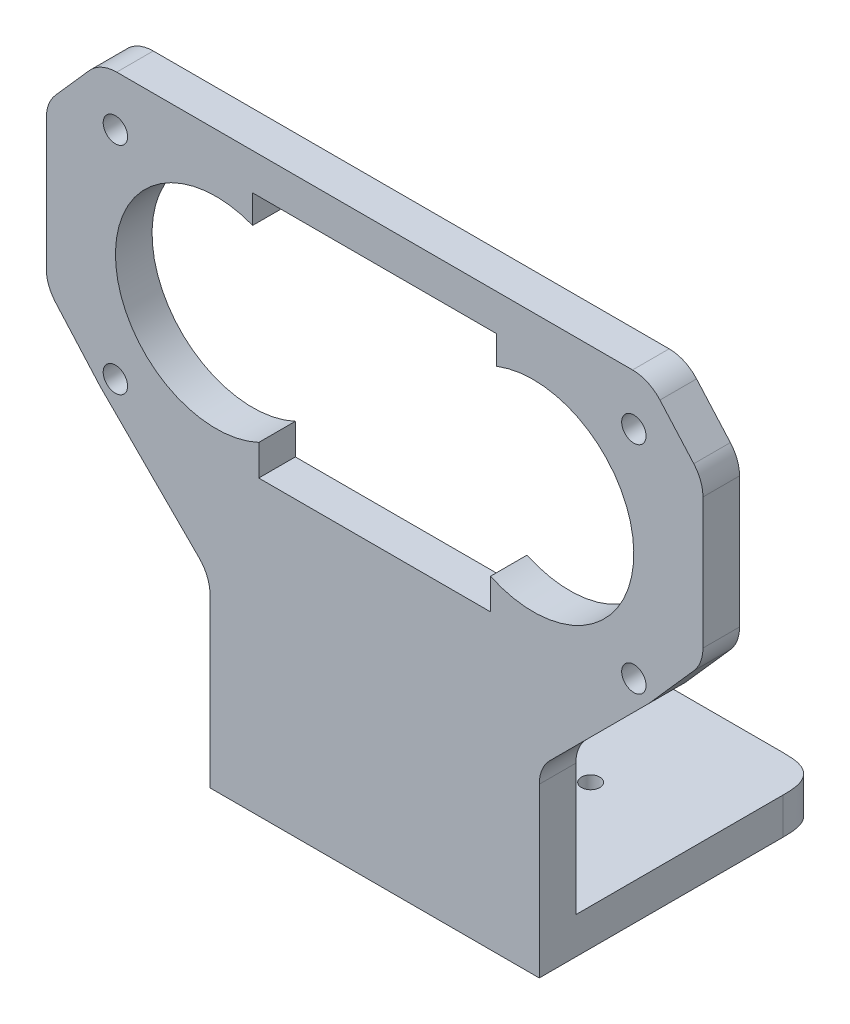
from build123d import *

# Parameters (mm, degrees)
EXTRUDE_1_DEPTH     = 3
SKETCH_2_W          = 27
SKETCH_2_H          = 3
EXTRUDE_2_DEPTH     = 20
FILLET_1_SIZE       = 3
FILLET_2_SIZE       = 3
SKETCH_3_R          = 2.5
SKETCH_3_R_2        = 0.75
CUT_EXTRUDE_1_DEPTH = 20
SKETCH_4_R          = 1
CUT_EXTRUDE_2_DEPTH = 10


with BuildPart() as part:
    # 草图1 → 凸台-拉伸1 (new body)
    with BuildSketch(Plane.XY):
        with BuildLine():
            Line((-10, 23), (-21.14797242, 23))
            ThreePointArc((-21.14797242, 23), (-22.380603493, 22.735072328), (-23.395529179, 21.987080425))
            Line((-23.395529179, 21.987080425), (-26.168091228, 18.851077224))
            ThreePointArc((-26.168091228, 18.851077224), (-26.72612445, 17.926383199), (-26.920534469, 16.863996799))
            Line((-26.920534469, 16.863996799), (-26.920534469, 6.136003201))
            ThreePointArc((-26.920534469, 6.136003201), (-26.72612445, 5.073616801), (-26.168091228, 4.148922776))
            Line((-26.168091228, 4.148922776), (-22.5, 0))
            Line((-22.5, 0), (-14.378679656, -8.121320344))
            ThreePointArc((-14.378679656, -8.121320344), (-13.728361402, -9.09459039), (-13.5, -10.242640687))
            Line((-13.5, -10.242640687), (-13.5, -24))
            Line((-13.5, -24), (13.5, -24))
            Line((13.5, -24), (13.5, -10.242640687))
            ThreePointArc((13.5, -10.242640687), (13.728361402, -9.09459039), (14.378679656, -8.121320344))
            Line((14.378679656, -8.121320344), (22.5, 0))
            Line((22.5, 0), (26.168091228, 4.148922776))
            ThreePointArc((26.168091228, 4.148922776), (26.72612445, 5.073616801), (26.920534469, 6.136003201))
            Line((26.920534469, 6.136003201), (26.920534469, 16.863996799))
            ThreePointArc((26.920534469, 16.863996799), (26.72612445, 17.926383199), (26.168091228, 18.851077224))
            Line((26.168091228, 18.851077224), (23.395529179, 21.987080425))
            ThreePointArc((23.395529179, 21.987080425), (22.380603493, 22.735072328), (21.14797242, 23))
            Line((21.14797242, 23), (10, 23))
            Line((10, 23), (-10, 23))
        make_face()
        with BuildLine():
            Line((-10, 20), (10, 20))
            Line((10, 20), (10, 17.685213074))
            ThreePointArc((10, 17.685213074), (21.245514188, 9.727978361), (9.5, 2.529223601))
            Line((9.5, 2.529223601), (9.5, 0))
            Line((9.5, 0), (-9.5, 0))
            Line((-9.5, 0), (-9.5, 2.529223601))
            ThreePointArc((-9.5, 2.529223601), (-21.245514188, 9.727978361), (-10, 17.685213074))
            Line((-10, 17.685213074), (-10, 20))
        make_face(mode=Mode.SUBTRACT)
    extrude(amount=EXTRUDE_1_DEPTH)

    # 草图2 → 凸台-拉伸2 (add)
    with BuildSketch(Plane(origin=(0, 0, 0), x_dir=(-1, 0, 0), z_dir=(0, 0, -1))):
        with Locations((0, -22.5)):
            Rectangle(SKETCH_2_W, SKETCH_2_H)
    extrude(amount=EXTRUDE_2_DEPTH)

    # 圆角1
    # a fillet whose section is not a circle: 3 mm, written as the material it takes off along each edge
    with BuildSketch(Plane(origin=(13.5, -31.5, -20), x_dir=(-1, 0, 0), z_dir=(0, 1, 0))) as fillet_1_piece_1:
        with BuildLine():
            add(Edge.make_bspline([(FILLET_1_SIZE, 0), (FILLET_1_SIZE * 0.831801948466, 0), (FILLET_1_SIZE * 0.663603896932, 0), (FILLET_1_SIZE * 0.292893218813, FILLET_1_SIZE * 0.0716919198361), (FILLET_1_SIZE * 0.0716919198361, FILLET_1_SIZE * 0.292893218813), (0, FILLET_1_SIZE * 0.663603896932), (0, FILLET_1_SIZE * 0.831801948466), (0, FILLET_1_SIZE)], knots=[0, 0, 0, 0, 0, 0, 0.5, 0.5, 1, 1, 1, 1, 1, 1], degree=5))
            Line((0, FILLET_1_SIZE), (0, 0))
            Line((0, 0), (FILLET_1_SIZE, 0))
        make_face()
    extrude(amount=18, mode=Mode.SUBTRACT)

    # 圆角2
    # a fillet whose section is not a circle: 3 mm, written as the material it takes off along each edge
    with BuildSketch(Plane(origin=(-13.5, -13.5, -20), x_dir=(0, 0, 1), z_dir=(0, -1, 0))) as fillet_2_piece_1:
        with BuildLine():
            add(Edge.make_bspline([(FILLET_2_SIZE, 0), (FILLET_2_SIZE * 0.831801948466, 0), (FILLET_2_SIZE * 0.663603896932, 0), (FILLET_2_SIZE * 0.292893218813, -FILLET_2_SIZE * 0.0716919198361), (FILLET_2_SIZE * 0.0716919198361, -FILLET_2_SIZE * 0.292893218813), (0, -FILLET_2_SIZE * 0.663603896932), (0, -FILLET_2_SIZE * 0.831801948466), (0, -FILLET_2_SIZE)], knots=[0, 0, 0, 0, 0, 0, 0.5, 0.5, 1, 1, 1, 1, 1, 1], degree=5))
            Line((0, -FILLET_2_SIZE), (0, 0))
            Line((0, 0), (FILLET_2_SIZE, 0))
        make_face()
    extrude(amount=18, mode=Mode.SUBTRACT)

    # 草图3 → 切除-拉伸1 (cut)
    with BuildSketch(Plane(origin=(0, -21, 0), x_dir=(1, 0, 0), z_dir=(0, 1, 0))):
        with Locations(Location((0, 10, 0), (0, 0, 270))):
            Circle(SKETCH_3_R)
        with Locations(Location((-4.71, 10, 0), (0, 0, 270))):
            Circle(SKETCH_3_R_2)
        with Locations(Location((0, 14.32, 0), (0, 0, 270))):
            Circle(SKETCH_3_R_2)
        with Locations(Location((0, 5.68, 0), (0, 0, 270))):
            Circle(SKETCH_3_R_2)
        with Locations(Location((4.71, 10, 0), (0, 0, 270))):
            Circle(SKETCH_3_R_2)
    extrude(amount=-CUT_EXTRUDE_1_DEPTH, mode=Mode.SUBTRACT)

    # 草图4 → 切除-拉伸2 (cut)
    with BuildSketch(Plane.XY.offset(3)):
        with Locations((-21.255, 18.855)):
            Circle(SKETCH_4_R)
        with Locations((-21.255, 1.145)):
            Circle(SKETCH_4_R)
        with Locations((21.255, 18.855)):
            Circle(SKETCH_4_R)
        with Locations((21.255, 1.145)):
            Circle(SKETCH_4_R)
    extrude(amount=-CUT_EXTRUDE_2_DEPTH, mode=Mode.SUBTRACT)


solid = part.part
